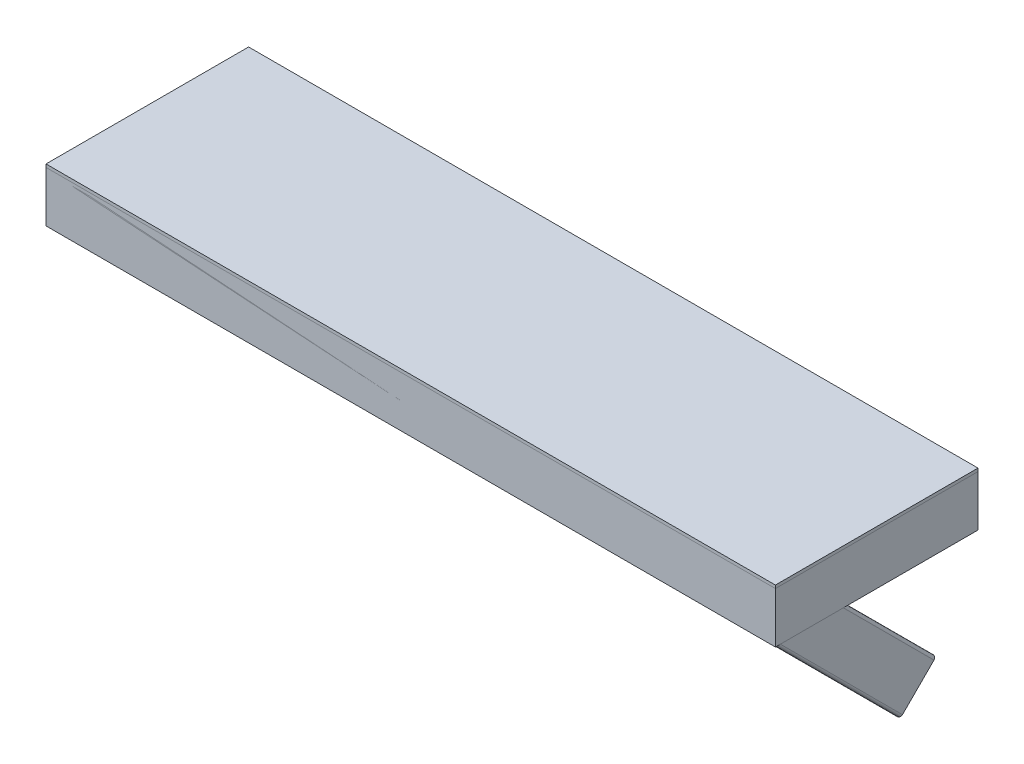
from build123d import *

# Parameters (mm, degrees)
SKETCH_1_W              = 720
SKETCH_1_H              = 150
EXTRUDE_1_DEPTH         = 25
SKETCH_2_W              = 720
SKETCH_2_H              = 50
EXTRUDE_2_DEPTH         = 50
F_50_START              = -335
F_50_X_25_X_3_1_DEPTH   = 670
F_50_START_2            = -75
F_50_X_25_X_3_1_2_DEPTH = 150
F_50_X_25_X_3_1_3_DEPTH = 150
BODY_START              = -75
BODY_4_RUN_ON_DEPTH     = 50
BODY_3_RUN_ON_DEPTH     = 50
SKETCH_5_W              = 720
SKETCH_5_H              = 200
EXTRUDE_3_DEPTH         = 3
F_50_X_25_X_3_2_DEPTH   = 183.847763109


# Read off the part's stored shape, not the designer's step: Прямоугольная труба 50 X 25 X 3(1), Отсечь/Удлинить2
with BuildPart() as part:
    # Эскиз1 → Бобышка-Вытянуть1 (new, symmetric)
    with BuildSketch(Plane(origin=(0, 0, 0), x_dir=(1, 0, 0), z_dir=(0, 1, 0))):
        Rectangle(SKETCH_1_W, SKETCH_1_H)
    extrude(amount=EXTRUDE_1_DEPTH, both=True)

    # Эскиз2 → Бобышка-Вытянуть2 (add)
    with BuildSketch(Plane(origin=(0, 0, -75), x_dir=(-1, 0, 0), z_dir=(0, 0, -1))):
        Rectangle(SKETCH_2_W, SKETCH_2_H)
    extrude(amount=EXTRUDE_2_DEPTH)


with BuildPart() as body_2:
    # Прямоугольная труба 50 X 25 X 3(1) outline → Прямоугольная труба 50 X 25 X 3(1) (new body)
    with BuildSketch(Plane.YZ.offset(F_50_START)):
        with BuildLine():
            Line((-21.99, 50), (21.99, 50))
            ThreePointArc((21.99, 50), (24.118391411, 50.881608589), (25, 53.01))
            Line((25, 53.01), (25, 71.99))
            ThreePointArc((25, 71.99), (24.118391411, 74.118391411), (21.99, 75))
            Line((21.99, 75), (-21.99, 75))
            ThreePointArc((-21.99, 75), (-24.118391411, 74.118391411), (-25, 71.99))
            Line((-25, 71.99), (-25, 53.01))
            ThreePointArc((-25, 53.01), (-24.118391411, 50.881608589), (-21.99, 50))
        make_face()
        with BuildLine():
            ThreePointArc((-22, 71.99), (-21.997071068, 71.997071068), (-21.99, 72))
            Line((-21.99, 72), (21.99, 72))
            ThreePointArc((21.99, 72), (21.997071068, 71.997071068), (22, 71.99))
            Line((22, 71.99), (22, 53.01))
            ThreePointArc((22, 53.01), (21.997071068, 53.002928932), (21.99, 53))
            Line((21.99, 53), (-21.99, 53))
            ThreePointArc((-21.99, 53), (-21.997071068, 53.002928932), (-22, 53.01))
            Line((-22, 53.01), (-22, 71.99))
        make_face(mode=Mode.SUBTRACT)
    extrude(amount=F_50_X_25_X_3_1_DEPTH)


with BuildPart() as body_3:
    # 50 X 25 X 3_1 2 outline → 50 X 25 X 3_1 2 (new body)
    with BuildSketch(Plane.XY.offset(F_50_START_2)):
        with BuildLine():
            ThreePointArc((360, 21.99), (359.118391411, 24.118391411), (356.99, 25))
            Line((356.99, 25), (338.01, 25))
            ThreePointArc((338.01, 25), (335.881608589, 24.118391411), (335, 21.99))
            Line((335, 21.99), (335, -21.99))
            ThreePointArc((335, -21.99), (335.881608589, -24.118391411), (338.01, -25))
            Line((338.01, -25), (356.99, -25))
            ThreePointArc((356.99, -25), (359.118391411, -24.118391411), (360, -21.99))
            Line((360, -21.99), (360, 21.99))
        make_face()
        with BuildLine():
            Line((338, -21.99), (338, 21.99))
            ThreePointArc((338, 21.99), (338.002928932, 21.997071068), (338.01, 22))
            Line((338.01, 22), (356.99, 22))
            ThreePointArc((356.99, 22), (356.997071068, 21.997071068), (357, 21.99))
            Line((357, 21.99), (357, -21.99))
            ThreePointArc((357, -21.99), (356.997071068, -21.997071068), (356.99, -22))
            Line((356.99, -22), (338.01, -22))
            ThreePointArc((338.01, -22), (338.002928932, -21.997071068), (338, -21.99))
        make_face(mode=Mode.SUBTRACT)
    extrude(amount=F_50_X_25_X_3_1_2_DEPTH)

    # 50 X 25 X 3_1 2 outline → body 3 run on (add)
    with BuildSketch(Plane.XY.offset(BODY_START)):
        with BuildLine():
            ThreePointArc((360, 21.99), (359.118391411, 24.118391411), (356.99, 25))
            Line((356.99, 25), (338.01, 25))
            ThreePointArc((338.01, 25), (335.881608589, 24.118391411), (335, 21.99))
            Line((335, 21.99), (335, -21.99))
            ThreePointArc((335, -21.99), (335.881608589, -24.118391411), (338.01, -25))
            Line((338.01, -25), (356.99, -25))
            ThreePointArc((356.99, -25), (359.118391411, -24.118391411), (360, -21.99))
            Line((360, -21.99), (360, 21.99))
        make_face()
        with BuildLine():
            Line((338, -21.99), (338, 21.99))
            ThreePointArc((338, 21.99), (338.002928932, 21.997071068), (338.01, 22))
            Line((338.01, 22), (356.99, 22))
            ThreePointArc((356.99, 22), (356.997071068, 21.997071068), (357, 21.99))
            Line((357, 21.99), (357, -21.99))
            ThreePointArc((357, -21.99), (356.997071068, -21.997071068), (356.99, -22))
            Line((356.99, -22), (338.01, -22))
            ThreePointArc((338.01, -22), (338.002928932, -21.997071068), (338, -21.99))
        make_face(mode=Mode.SUBTRACT)
    extrude(amount=-BODY_3_RUN_ON_DEPTH)


with BuildPart() as body_4:
    # 50 X 25 X 3_1 3 outline → 50 X 25 X 3_1 3 (new body)
    with BuildSketch(Plane.XY.offset(F_50_START_2)):
        with BuildLine():
            ThreePointArc((-335, 21.99), (-335.881608589, 24.118391411), (-338.01, 25))
            Line((-338.01, 25), (-356.99, 25))
            ThreePointArc((-356.99, 25), (-359.118391411, 24.118391411), (-360, 21.99))
            Line((-360, 21.99), (-360, -21.99))
            ThreePointArc((-360, -21.99), (-359.118391411, -24.118391411), (-356.99, -25))
            Line((-356.99, -25), (-338.01, -25))
            ThreePointArc((-338.01, -25), (-335.881608589, -24.118391411), (-335, -21.99))
            Line((-335, -21.99), (-335, 21.99))
        make_face()
        with BuildLine():
            Line((-357, -21.99), (-357, 21.99))
            ThreePointArc((-357, 21.99), (-356.997071068, 21.997071068), (-356.99, 22))
            Line((-356.99, 22), (-338.01, 22))
            ThreePointArc((-338.01, 22), (-338.002928932, 21.997071068), (-338, 21.99))
            Line((-338, 21.99), (-338, -21.99))
            ThreePointArc((-338, -21.99), (-338.002928932, -21.997071068), (-338.01, -22))
            Line((-338.01, -22), (-356.99, -22))
            ThreePointArc((-356.99, -22), (-356.997071068, -21.997071068), (-357, -21.99))
        make_face(mode=Mode.SUBTRACT)
    extrude(amount=F_50_X_25_X_3_1_3_DEPTH)

    # 50 X 25 X 3_1 3 outline → body 4 run on (add)
    with BuildSketch(Plane.XY.offset(BODY_START)):
        with BuildLine():
            ThreePointArc((-335, 21.99), (-335.881608589, 24.118391411), (-338.01, 25))
            Line((-338.01, 25), (-356.99, 25))
            ThreePointArc((-356.99, 25), (-359.118391411, 24.118391411), (-360, 21.99))
            Line((-360, 21.99), (-360, -21.99))
            ThreePointArc((-360, -21.99), (-359.118391411, -24.118391411), (-356.99, -25))
            Line((-356.99, -25), (-338.01, -25))
            ThreePointArc((-338.01, -25), (-335.881608589, -24.118391411), (-335, -21.99))
            Line((-335, -21.99), (-335, 21.99))
        make_face()
        with BuildLine():
            Line((-357, -21.99), (-357, 21.99))
            ThreePointArc((-357, 21.99), (-356.997071068, 21.997071068), (-356.99, 22))
            Line((-356.99, 22), (-338.01, 22))
            ThreePointArc((-338.01, 22), (-338.002928932, 21.997071068), (-338, 21.99))
            Line((-338, 21.99), (-338, -21.99))
            ThreePointArc((-338, -21.99), (-338.002928932, -21.997071068), (-338.01, -22))
            Line((-338.01, -22), (-356.99, -22))
            ThreePointArc((-356.99, -22), (-356.997071068, -21.997071068), (-357, -21.99))
        make_face(mode=Mode.SUBTRACT)
    extrude(amount=-BODY_4_RUN_ON_DEPTH)


with BuildPart() as body_5:
    # Эскиз5 → Бобышка-Вытянуть3 (new body)
    with BuildSketch(Plane(origin=(0, 25, 0), x_dir=(1, 0, 0), z_dir=(0, 1, 0))):
        with Locations((0, 25)):
            Rectangle(SKETCH_5_W, SKETCH_5_H)
    extrude(amount=EXTRUDE_3_DEPTH)


with BuildPart() as body_6:
    # Sketch11 → Прямоугольная труба 50 X 25 X 3(2) (new body)
    with BuildSketch(Plane(origin=(347.5, 0, 64), x_dir=(1, 0, 0), z_dir=(0, -0.7071067811865487, -0.7071067811865465))):
        with BuildLine():
            Line((-9.49, -25), (9.49, -25))
            ThreePointArc((9.49, -25), (11.618391411, -24.118391411), (12.5, -21.99))
            Line((12.5, -21.99), (12.5, 21.99))
            ThreePointArc((12.5, 21.99), (11.618391411, 24.118391411), (9.49, 25))
            Line((9.49, 25), (-9.49, 25))
            ThreePointArc((-9.49, 25), (-11.618391411, 24.118391411), (-12.5, 21.99))
            Line((-12.5, 21.99), (-12.5, -21.99))
            ThreePointArc((-12.5, -21.99), (-11.618391411, -24.118391411), (-9.49, -25))
        make_face()
        with BuildLine():
            Line((-9.49, -22), (9.49, -22))
            ThreePointArc((9.49, -22), (9.497071068, -21.997071068), (9.5, -21.99))
            Line((9.5, -21.99), (9.5, 21.99))
            ThreePointArc((9.5, 21.99), (9.497071068, 21.997071068), (9.49, 22))
            Line((9.49, 22), (-9.49, 22))
            ThreePointArc((-9.49, 22), (-9.497071068, 21.997071068), (-9.5, 21.99))
            Line((-9.5, 21.99), (-9.5, -21.99))
            ThreePointArc((-9.5, -21.99), (-9.497071068, -21.997071068), (-9.49, -22))
        make_face(mode=Mode.SUBTRACT)
    extrude(amount=F_50_X_25_X_3_2_DEPTH)


with BuildPart() as body_7:
    # Weld Trim 2: the piece on the far side of the plane
    add(body_6.part)
    split(bisect_by=Plane(origin=(0, -25, 0), x_dir=(1, 0, 0), z_dir=(0, 1, 0)), keep=Keep.BOTTOM)


with BuildPart() as body_6_1:
    add(body_6.part)

    # Weld Trim 2
    split(bisect_by=Plane(origin=(0, -25, 0), x_dir=(1, 0, 0), z_dir=(0, 1, 0)), keep=Keep.TOP)


with BuildPart() as body_7_2:
    # Зеркальное отражение1: mirrored copy
    add(body_7.part.mirror(Plane(origin=(0, 0, 0), x_dir=(0, 0, 1), z_dir=(1, 0, 0))))


solid = Compound([part.part, body_2.part, body_3.part, body_4.part, body_5.part, body_7.part, body_7_2.part])
